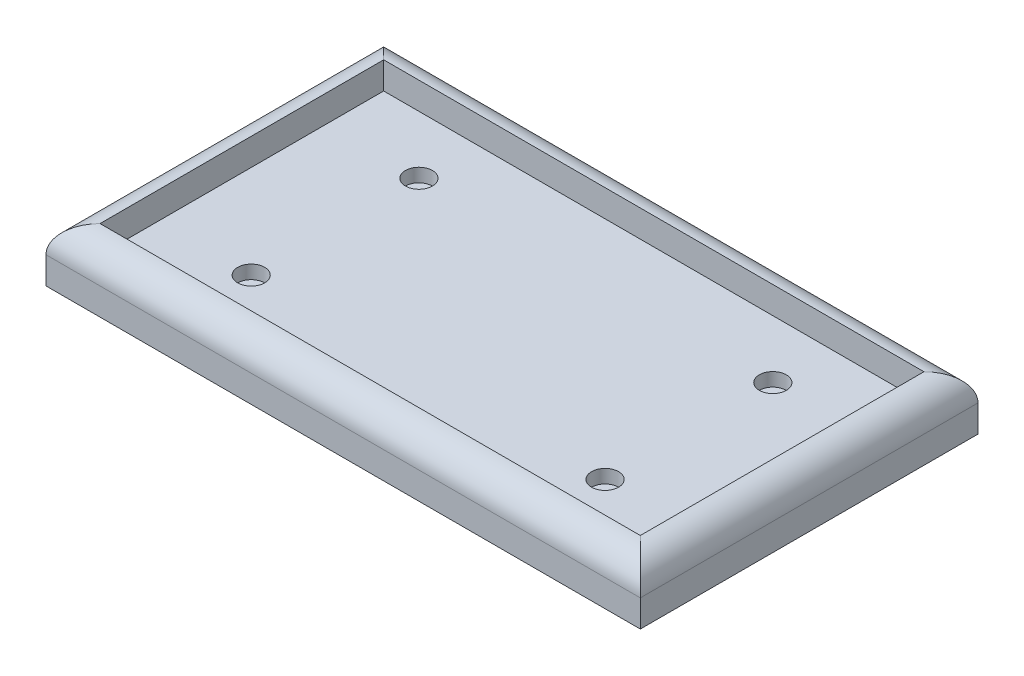
from build123d import *

# Parameters (mm, degrees)
SKETCH1_W           = 220
SKETCH1_H           = 125
BOSS_EXTRUDE1_DEPTH = 20
SKETCH2_W           = 200
SKETCH2_H           = 105
CUT_EXTRUDE1_DEPTH  = 10
FILLET1_R           = 10
SKETCH3_W           = 171
SKETCH3_H           = 102.09
BOSS_EXTRUDE2_DEPTH = 5
SKETCH4_R           = 2
CUT_EXTRUDE2_DEPTH  = 129.962203765
SKETCH5_R           = 5
CUT_EXTRUDE3_DEPTH  = 5


with BuildPart() as part:
    # Sketch1 → Boss-Extrude1 (new body)
    with BuildSketch(Plane(origin=(0, 0, 0), x_dir=(1, 0, 0), z_dir=(0, 1, 0))):
        Rectangle(SKETCH1_W, SKETCH1_H)
    extrude(amount=BOSS_EXTRUDE1_DEPTH)

    # Sketch2 → Cut-Extrude1 (cut)
    with BuildSketch(Plane(origin=(0, 20, 0), x_dir=(1, 0, 0), z_dir=(0, 1, 0))):
        Rectangle(SKETCH2_W, SKETCH2_H)
    extrude(amount=-CUT_EXTRUDE1_DEPTH, mode=Mode.SUBTRACT)

    # Fillet1
    fillet1_edges = [part.edges().sort_by_distance(p)[0] for p in [
        (110, 20, 0),
        (0, 20, -62.5),
        (-110, 20, 0),
        (0, 20, 62.5),
    ]]
    fillet(fillet1_edges, radius=FILLET1_R - 0.0001)  # a hair under: the kernel refuses the full size

    # Sketch3 → Boss-Extrude2 (add)
    with BuildSketch(Plane.XZ):
        Rectangle(SKETCH3_W, SKETCH3_H)
    extrude(amount=BOSS_EXTRUDE2_DEPTH)

    # Sketch4 → Cut-Extrude2 (cut, through all)
    with BuildSketch(Plane.XZ.offset(5)):
        with Locations(Location((-65.5, 31.045, 0), (0, 0, 270))):
            Circle(SKETCH4_R)
        with Locations(Location((-65.5, -31.045, 0), (0, 0, 270))):
            Circle(SKETCH4_R)
        with Locations(Location((65.5, -31.045, 0), (0, 0, 270))):
            Circle(SKETCH4_R)
        with Locations(Location((65.5, 31.045, 0), (0, 0, 270))):
            Circle(SKETCH4_R)
    extrude(amount=-CUT_EXTRUDE2_DEPTH, mode=Mode.SUBTRACT)

    # Sketch5 → Cut-Extrude3 (cut)
    with BuildSketch(Plane(origin=(0, 10, 0), x_dir=(1, 0, 0), z_dir=(0, 1, 0))):
        with Locations(Location((-65.5, 31.045, 0), (0, 0, 270))):
            Circle(SKETCH5_R)
        with Locations(Location((-65.5, -31.045, 0), (0, 0, 270))):
            Circle(SKETCH5_R)
        with Locations(Location((65.5, -31.045, 0), (0, 0, 270))):
            Circle(SKETCH5_R)
        with Locations(Location((65.5, 31.045, 0), (0, 0, 270))):
            Circle(SKETCH5_R)
    extrude(amount=-CUT_EXTRUDE3_DEPTH, mode=Mode.SUBTRACT)


solid = part.part
